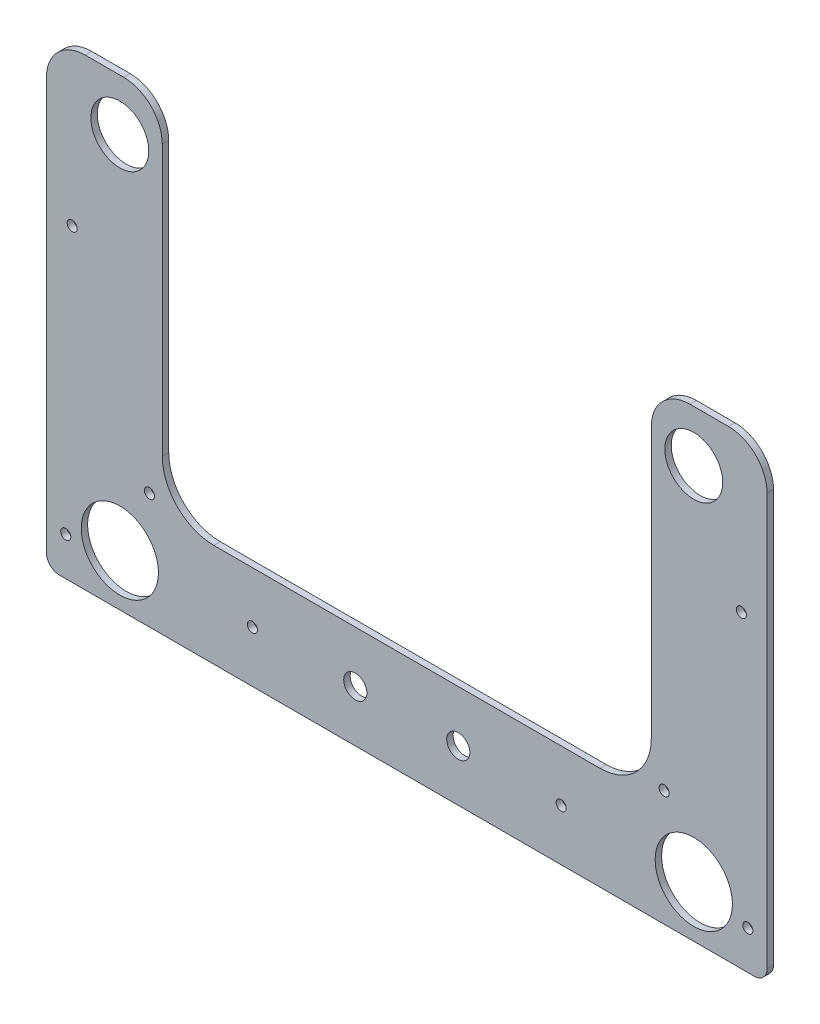
from build123d import *

# Parameters (mm, degrees)
SKETCH1_R           = 14.2875
SKETCH1_R_2         = 19.05
SKETCH1_R_3         = 2.4892
SKETCH1_R_4         = 5.715
BOSS_EXTRUDE3_DEPTH = 3.175
SKETCH2_W           = 355.6
SKETCH2_H           = 19.05
CUT_EXTRUDE1_DEPTH  = 290.621961572
FILLET1_R           = 19.05


with BuildPart() as part:
    # Sketch1 → Boss-Extrude3 (new body)
    with BuildSketch(Plane.XY):
        with BuildLine():
            Line((120.65, -152.4), (120.65, -6.35))
            Line((120.65, -6.35), (120.65, 6.35))
            ThreePointArc((120.65, 6.35), (124.369743879, 15.330256121), (133.35, 19.05))
            Line((133.35, 19.05), (165.1, 19.05))
            ThreePointArc((165.1, 19.05), (174.080256121, 15.330256121), (177.8, 6.35))
            Line((177.8, 6.35), (177.8, -6.35))
            Line((177.8, -6.35), (177.8, -222.25))
            ThreePointArc((177.8, -222.25), (175.940128061, -226.740128061), (171.45, -228.6))
            Line((171.45, -228.6), (12.7, -228.6))
            Line((12.7, -228.6), (-12.7, -228.6))
            Line((-12.7, -228.6), (-171.45, -228.6))
            ThreePointArc((-171.45, -228.6), (-175.940128061, -226.740128061), (-177.8, -222.25))
            Line((-177.8, -222.25), (-177.8, -6.35))
            Line((-177.8, -6.35), (-177.8, 6.35))
            ThreePointArc((-177.8, 6.35), (-174.080256121, 15.330256121), (-165.1, 19.05))
            Line((-165.1, 19.05), (-133.35, 19.05))
            ThreePointArc((-133.35, 19.05), (-124.369743879, 15.330256121), (-120.65, 6.35))
            Line((-120.65, 6.35), (-120.65, -6.35))
            Line((-120.65, -6.35), (-120.65, -152.4))
            ThreePointArc((-120.65, -152.4), (-113.210512242, -170.360512242), (-95.25, -177.8))
            Line((-95.25, -177.8), (-12.7, -177.8))
            Line((-12.7, -177.8), (12.7, -177.8))
            Line((12.7, -177.8), (95.25, -177.8))
            ThreePointArc((95.25, -177.8), (113.210512242, -170.360512242), (120.65, -152.4))
        make_face()
        with Locations((141.605, -25.4)):
            Circle(SKETCH1_R, mode=Mode.SUBTRACT)
        with Locations((-141.605, -25.4)):
            Circle(SKETCH1_R, mode=Mode.SUBTRACT)
        with Locations((-141.605, -203.2)):
            Circle(SKETCH1_R_2, mode=Mode.SUBTRACT)
        with Locations((141.605, -203.2)):
            Circle(SKETCH1_R_2, mode=Mode.SUBTRACT)
        with Locations((-76.2, -203.2)):
            Circle(SKETCH1_R_3, mode=Mode.SUBTRACT)
        with Locations((76.2, -203.2)):
            Circle(SKETCH1_R_3, mode=Mode.SUBTRACT)
        with Locations((-25.4, -203.2)):
            Circle(SKETCH1_R_4, mode=Mode.SUBTRACT)
        with Locations((-149.225, 6.35)):
            Circle(SKETCH1_R_3, mode=Mode.SUBTRACT)
        with Locations((149.225, 6.35)):
            Circle(SKETCH1_R_3, mode=Mode.SUBTRACT)
        with Locations((-168.275, -209.55)):
            Circle(SKETCH1_R_3, mode=Mode.SUBTRACT)
        with Locations((168.275, -209.55)):
            Circle(SKETCH1_R_3, mode=Mode.SUBTRACT)
        with Locations((-165.1, -76.2)):
            Circle(SKETCH1_R_3, mode=Mode.SUBTRACT)
        with Locations((165.1, -76.2)):
            Circle(SKETCH1_R_3, mode=Mode.SUBTRACT)
        with Locations((-127, -171.45)):
            Circle(SKETCH1_R_3, mode=Mode.SUBTRACT)
        with Locations((127, -171.45)):
            Circle(SKETCH1_R_3, mode=Mode.SUBTRACT)
        with Locations((25.4, -203.2)):
            Circle(SKETCH1_R_4, mode=Mode.SUBTRACT)
    extrude(amount=BOSS_EXTRUDE3_DEPTH)

    # Sketch2 → Cut-Extrude1 (cut, through all)
    with BuildSketch(Plane.XY.offset(3.175)):
        with Locations((0, 9.525)):
            Rectangle(SKETCH2_W, SKETCH2_H)
    extrude(amount=-CUT_EXTRUDE1_DEPTH, mode=Mode.SUBTRACT)

    # Fillet1
    fillet1_edges = [part.edges().sort_by_distance(p)[0] for p in [
        (177.8, 0, 1.5875),
        (120.65, 0, 1.5875),
        (-120.65, 0, 1.5875),
        (-177.8, 0, 1.5875),
    ]]
    fillet(fillet1_edges, radius=FILLET1_R)


solid = part.part
